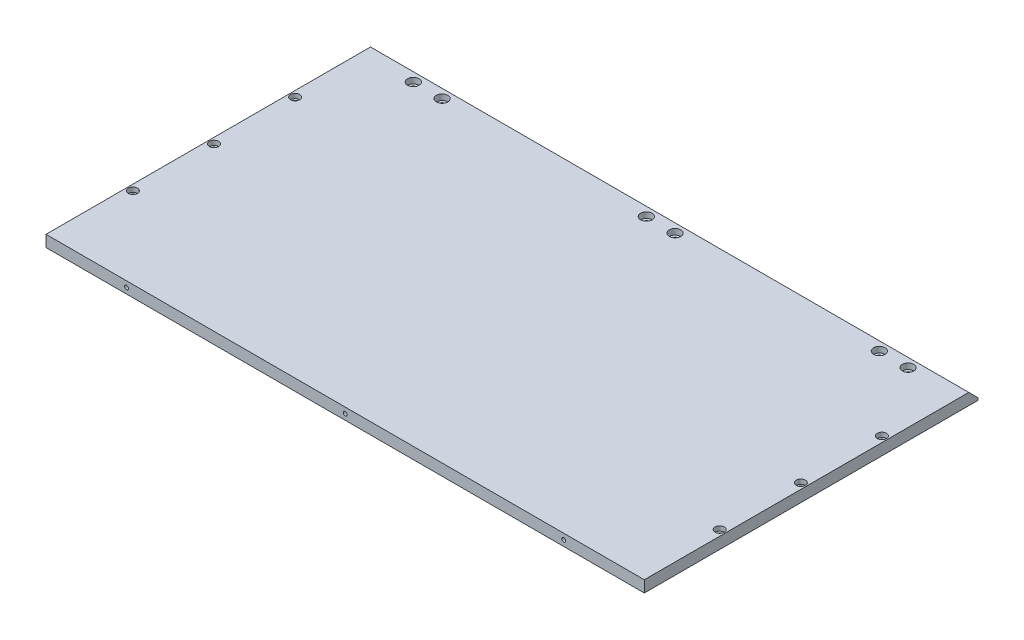
from build123d import *

# Parameters (mm, degrees)
SKETCH1_W                      = 520
SKETCH1_H                      = 290
BOSS_EXTRUDE1_DEPTH            = 10
CBORE_FOR_M5_SHCS1_D           = 5.5
CBORE_FOR_M5_SHCS1_DEPTH       = 11.5
CBORE_FOR_M5_SHCS1_CBORE_D     = 10
CBORE_FOR_M5_SHCS1_CBORE_DEPTH = 5
CBORE_FOR_M5_SHCS1_TIP         = 1.652366702
CUT_EXTRUDE1_DEPTH             = 390.615194776
CUT_EXTRUDE1_DEPTH_BACK        = 390.615194776
CBORE_FOR_M4_SHCS1_D           = 4.5
CBORE_FOR_M4_SHCS1_CBORE_D     = 8
CBORE_FOR_M4_SHCS1_CBORE_DEPTH = 4
M4X0_7_TAPPED_HOLE1_D          = 3.3
M4X0_7_TAPPED_HOLE1_DEPTH      = 12
M4X0_7_TAPPED_HOLE1_TIP        = 0.991420021


with BuildPart() as part:
    # Sketch1 → Boss-Extrude1 (new body)
    with BuildSketch(Plane(origin=(0, 0, 0), x_dir=(1, 0, 0), z_dir=(0, 1, 0))):
        with Locations((0, 145)):
            Rectangle(SKETCH1_W, SKETCH1_H)
    extrude(amount=BOSS_EXTRUDE1_DEPTH)

    # CBORE for M5 SHCS1
    with Locations(Plane(origin=(0, 10, 0), x_dir=(1, 0, 0), z_dir=(0, 1, 0))):
        with Locations((-215, 274.25), (-190, 274.25), (-12.5, 274.25), (12.5, 274.25), (190, 274.25), (215, 274.25)):
            CounterBoreHole(CBORE_FOR_M5_SHCS1_D / 2, CBORE_FOR_M5_SHCS1_CBORE_D / 2, CBORE_FOR_M5_SHCS1_CBORE_DEPTH, depth=CBORE_FOR_M5_SHCS1_DEPTH)
            with Locations((0, 0, -(CBORE_FOR_M5_SHCS1_DEPTH + CBORE_FOR_M5_SHCS1_TIP / 2))):  # 118° drill point
                Cone(0, CBORE_FOR_M5_SHCS1_D / 2, CBORE_FOR_M5_SHCS1_TIP, mode=Mode.SUBTRACT)

    # Sketch2 → Cut-Extrude1 (cut, two sides: drawn at the far end of the back side and taken through both)
    with BuildSketch(Plane(origin=(0, 0, 0), x_dir=(0, 0, -1), z_dir=(1, 0, 0)).offset(-CUT_EXTRUDE1_DEPTH_BACK)):
        Polygon((290, 2), (290, 10), (282, 10), align=None)
    extrude(amount=CUT_EXTRUDE1_DEPTH + CUT_EXTRUDE1_DEPTH_BACK, mode=Mode.SUBTRACT)

    # CBORE for M4 SHCS1 (through all)
    with Locations(Plane(origin=(0, 10, 0), x_dir=(1, 0, 0), z_dir=(0, 1, 0))):
        with Locations((255, 211.5), (255, 141), (255, 70.5)):
            cbore_for_m4_shcs1 = CounterBoreHole(CBORE_FOR_M4_SHCS1_D / 2, CBORE_FOR_M4_SHCS1_CBORE_D / 2, CBORE_FOR_M4_SHCS1_CBORE_DEPTH)

    # Mirror1: CBORE for M4 SHCS1 across plane
    add(cbore_for_m4_shcs1.mirror(Plane(origin=(0, 0, 0), x_dir=(0, 0, 1), z_dir=(1, 0, 0))), mode=Mode.SUBTRACT)

    # M4x0.7 Tapped Hole1
    with Locations(Plane.XY):
        with Locations((-190, 5), (0, 5), (190, 5)):
            Hole(M4X0_7_TAPPED_HOLE1_D / 2, depth=M4X0_7_TAPPED_HOLE1_DEPTH)
            with Locations((0, 0, -(M4X0_7_TAPPED_HOLE1_DEPTH + M4X0_7_TAPPED_HOLE1_TIP / 2))):  # 118° drill point
                Cone(0, M4X0_7_TAPPED_HOLE1_D / 2, M4X0_7_TAPPED_HOLE1_TIP, mode=Mode.SUBTRACT)


solid = part.part
